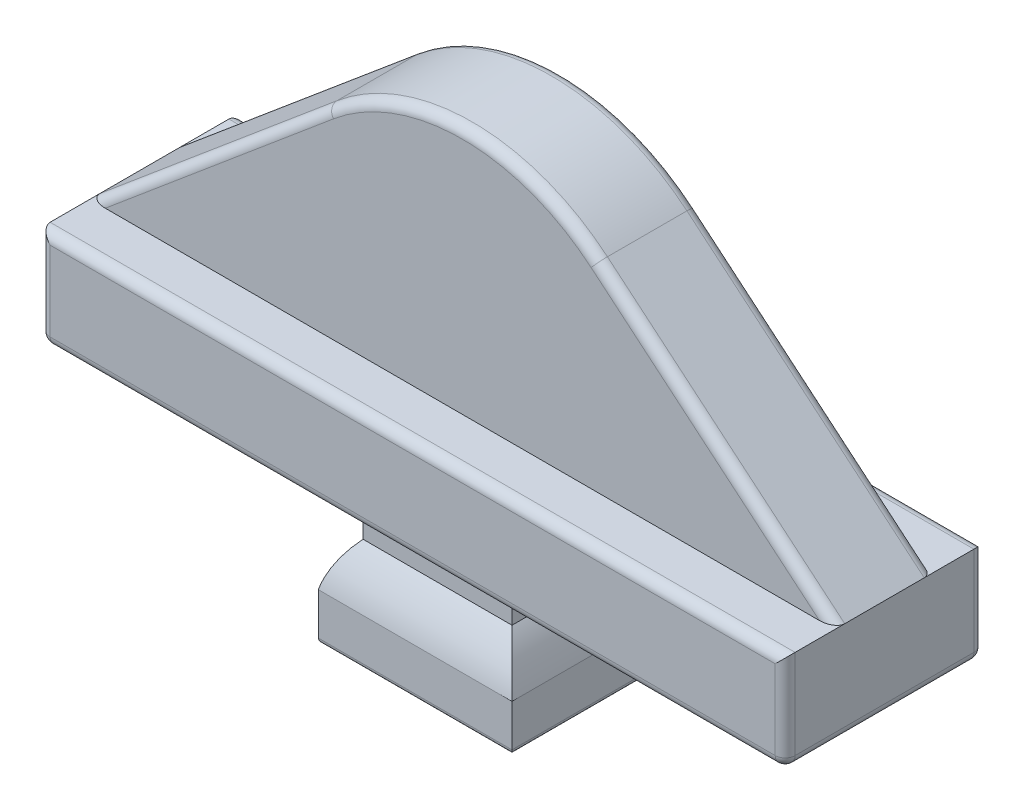
from build123d import *

# Parameters (mm, degrees)
EXTRUDE_1_DEPTH          = 2
EXTRUDE_1_DEPTH_BACK     = 2
SKETCH_1_W               = 15
SKETCH_1_H               = 2
EXTRUDE_2_DEPTH          = 2
EXTRUDE_2_DEPTH_BACK     = 2
CUT_EXTRUDE_1_DEPTH      = 2
CUT_EXTRUDE_1_DEPTH_BACK = 2
EXTRUDE_3_DEPTH          = 1
EXTRUDE_3_DEPTH_BACK     = 1
FILLET_2_R               = 0.2
FILLET_4_R               = 0.2
FILLET_5_R               = 0.2
FILLET_7_R               = 0.1


with BuildPart() as part:
    # 草图1 → 凸台-拉伸1 (new, two sides: drawn at the far end of the back side and taken through both)
    with BuildSketch(Plane.XY.offset(-EXTRUDE_1_DEPTH_BACK)):
        Rectangle(SKETCH_1_W, SKETCH_1_H)
    extrude(amount=EXTRUDE_1_DEPTH + EXTRUDE_1_DEPTH_BACK)

    # 草图2 → 凸台-拉伸2 (add, two sides: drawn at the far end of the back side and taken through both)
    with BuildSketch(Plane.XY.offset(-EXTRUDE_2_DEPTH_BACK)):
        with BuildLine():
            Line((-1.5, -1), (1.5, -1))
            Line((1.5, -1), (1.5, -1.677124344))
            ThreePointArc((1.5, -1.677124344), (1.780042303, -2.088161527), (1.95, -2.555590279))
            Line((1.95, -2.555590279), (1.95, -3.5))
            Line((1.95, -3.5), (-1.95, -3.5))
            Line((-1.95, -3.5), (-1.95, -2.555590279))
            ThreePointArc((-1.95, -2.555590279), (-1.780042303, -2.088161527), (-1.5, -1.677124344))
            Line((-1.5, -1.677124344), (-1.5, -1))
        make_face()
    extrude(amount=EXTRUDE_2_DEPTH + EXTRUDE_2_DEPTH_BACK)

    # 草图3 → 切除-拉伸1 (cut, two sides: drawn at the far end of the back side and taken through both)
    with BuildSketch(Plane(origin=(0, 0, 0), x_dir=(0, 0, -1), z_dir=(1, 0, 0)).offset(-CUT_EXTRUDE_1_DEPTH_BACK)):
        with BuildLine():
            Line((1.5, -1), (1.5, -1.677124344))
            ThreePointArc((1.5, -1.677124344), (1.780042303, -2.088161527), (1.95, -2.555590279))
            Line((1.95, -2.555590279), (1.95, -3.5))
            Line((1.95, -3.5), (2, -3.5))
            Line((2, -3.5), (2, -1))
            Line((2, -1), (1.5, -1))
        make_face()
        with BuildLine():
            Line((-2, -1), (-1.5, -1))
            Line((-1.5, -1), (-1.5, -1.677124344))
            ThreePointArc((-1.5, -1.677124344), (-1.780042303, -2.088161527), (-1.95, -2.555590279))
            Line((-1.95, -2.555590279), (-1.95, -3.5))
            Line((-1.95, -3.5), (-2, -3.5))
            Line((-2, -3.5), (-2, -1))
        make_face()
    extrude(amount=CUT_EXTRUDE_1_DEPTH + CUT_EXTRUDE_1_DEPTH_BACK, mode=Mode.SUBTRACT)

    # 草图4 → 凸台-拉伸3 (add, two sides: drawn at the far end of the back side and taken through both)
    with BuildSketch(Plane.XY.offset(-EXTRUDE_3_DEPTH_BACK)):
        with BuildLine():
            Line((7.5, 1), (-7.5, 1))
            Line((-7.5, 1), (-2.721884275, 5.009315143))
            ThreePointArc((-2.721884275, 5.009315143), (0, 6), (2.721884275, 5.009315143))
            Line((2.721884275, 5.009315143), (7.5, 1))
        make_face()
    extrude(amount=EXTRUDE_3_DEPTH + EXTRUDE_3_DEPTH_BACK)

    # 圆角2
    fillet_2_edges = [part.edges().sort_by_distance(p)[0] for p in [
        (0, 1, -2),
        (-7.5, 0, -2),
        (0, -1, -2),
        (7.5, 0, -2),
        (-7.5, 0, 2),
        (0, 1, 2),
        (7.5, 0, 2),
        (0, -1, 2),
    ]]
    fillet(fillet_2_edges, radius=FILLET_2_R)

    # 圆角4
    # the kernel refuses this fillet: 0.2 mm, written as the material it takes off along each edge
    with BuildSketch(Plane(origin=(7.3, -0.8, -1.8), x_dir=(0, -1, 0), z_dir=(1, 0, 0))) as fillet_4_piece_1_section:
        Polygon((0, 0), (FILLET_4_R, 0), (FILLET_4_R, FILLET_4_R), (0, FILLET_4_R), align=None)
    fillet_4_piece_1 = extrude(amount=FILLET_4_R, mode=Mode.PRIVATE)
    fillet_4_piece_1 = fillet_4_piece_1 - Plane(origin=(7.3, -0.8, -1.8), x_dir=(0, 0.7071067811865475, 0.7071067811865475), z_dir=(1, 0, 0)) * Sphere(FILLET_4_R, mode=Mode.PRIVATE)
    add(fillet_4_piece_1, mode=Mode.SUBTRACT)
    with BuildSketch(Plane(origin=(-7.3, -0.8, -1.8), x_dir=(-1, 0, 0), z_dir=(0, -1, 0))) as fillet_4_piece_2_section:
        Polygon((0, 0), (FILLET_4_R, 0), (FILLET_4_R, FILLET_4_R), (0, FILLET_4_R), align=None)
    fillet_4_piece_2 = extrude(amount=FILLET_4_R, mode=Mode.PRIVATE)
    fillet_4_piece_2 = fillet_4_piece_2 - Plane(origin=(-7.3, -0.8, -1.8), x_dir=(0.7071067811865475, 0, 0.7071067811865475), z_dir=(0, -1, 0)) * Sphere(FILLET_4_R, mode=Mode.PRIVATE)
    add(fillet_4_piece_2, mode=Mode.SUBTRACT)
    with BuildSketch(Plane(origin=(7.3, -0.8, 1.8), x_dir=(0, -1, 0), z_dir=(1, 0, 0))) as fillet_4_piece_3_section:
        Polygon((0, 0), (FILLET_4_R, 0), (FILLET_4_R, -FILLET_4_R), (0, -FILLET_4_R), align=None)
    fillet_4_piece_3 = extrude(amount=FILLET_4_R, mode=Mode.PRIVATE)
    fillet_4_piece_3 = fillet_4_piece_3 - Plane(origin=(7.3, -0.8, 1.8), x_dir=(0, 0.7071067811865475, -0.7071067811865475), z_dir=(1, 0, 0)) * Sphere(FILLET_4_R, mode=Mode.PRIVATE)
    add(fillet_4_piece_3, mode=Mode.SUBTRACT)
    with BuildSketch(Plane(origin=(-7.3, -0.8, 1.8), x_dir=(-1, 0, 0), z_dir=(0, -1, 0))) as fillet_4_piece_4_section:
        Polygon((0, 0), (FILLET_4_R, 0), (FILLET_4_R, -FILLET_4_R), (0, -FILLET_4_R), align=None)
    fillet_4_piece_4 = extrude(amount=FILLET_4_R, mode=Mode.PRIVATE)
    fillet_4_piece_4 = fillet_4_piece_4 - Plane(origin=(-7.3, -0.8, 1.8), x_dir=(0.7071067811865475, 0, -0.7071067811865475), z_dir=(0, -1, 0)) * Sphere(FILLET_4_R, mode=Mode.PRIVATE)
    add(fillet_4_piece_4, mode=Mode.SUBTRACT)
    with BuildSketch(Plane(origin=(-7.5, -1, 1.8), x_dir=(1, 0, 0), z_dir=(0, 0, -1)), Plane(origin=(7.5, -1, 1.8), x_dir=(0, 1, 0), z_dir=(0, 0, -1))) as fillet_4_piece_5:
        with BuildLine():
            CenterArc((FILLET_4_R, -FILLET_4_R), FILLET_4_R, 90, 90)
            Line((0, -FILLET_4_R), (0, 0))
            Line((0, 0), (FILLET_4_R, 0))
        make_face()
    extrude(amount=3.6, mode=Mode.SUBTRACT)

    # 圆角5
    fillet_5_edges = [part.edges().sort_by_distance(p)[0] for p in [
        (5.110942137, 3.004657571, -1),
        (0, 6, -1),
        (5.110942137, 3.004657571, 1),
        (0, 6, 1),
        (-5.110942137, 3.004657571, -1),
        (-5.110942137, 3.004657571, 1),
    ]]
    fillet(fillet_5_edges, radius=FILLET_5_R)

    # 圆角7
    fillet_7_edges = [part.edges().sort_by_distance(p)[0] for p in [
        (0, -3.5, 1.95),
        (1.95, -3.5, 0),
        (-1.95, -3.5, 0),
        (0, -3.5, -1.95),
    ]]
    fillet(fillet_7_edges, radius=FILLET_7_R)


solid = part.part
